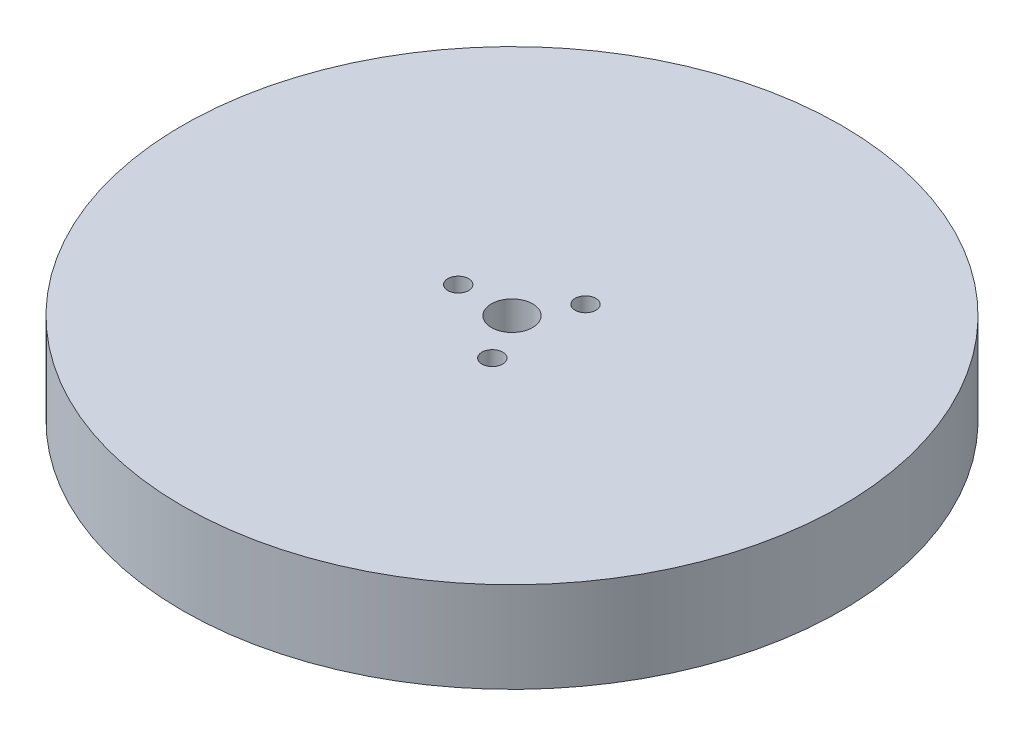
from build123d import *

# Parameters (mm, degrees)
SKETCH1_R           = 80
BOSS_EXTRUDE1_DEPTH = 22
SKETCH2_R           = 5
CUT_EXTRUDE1_DEPTH  = 116.256236274
SKETCH3_R           = 2.520042376
CUT_EXTRUDE2_DEPTH  = 17.07476964
CIRPATTERN1_COUNT   = 3


with BuildPart() as part:
    # Sketch1 → Boss-Extrude1 (new body)
    with BuildSketch(Plane(origin=(0, 0, 0), x_dir=(1, 0, 0), z_dir=(0, 1, 0))):
        Circle(SKETCH1_R)
    extrude(amount=BOSS_EXTRUDE1_DEPTH)

    # Sketch2 → Cut-Extrude1 (cut, through all)
    with BuildSketch(Plane(origin=(0, 0, 0), x_dir=(1, 0, 0), z_dir=(0, 1, 0))):
        Circle(SKETCH2_R)
    extrude(amount=CUT_EXTRUDE1_DEPTH, mode=Mode.SUBTRACT)

    # Sketch3 → Cut-Extrude2 (cut)
    with BuildSketch(Plane(origin=(0, 22, 0), x_dir=(1, 0, 0), z_dir=(0, 1, 0))):
        with Locations((-13.058893853, 0)):
            Circle(SKETCH3_R)
    cut_extrude2 = extrude(amount=-CUT_EXTRUDE2_DEPTH, mode=Mode.SUBTRACT)

    # CirPattern1: Cut-Extrude2 ×3 about axis
    cirpattern1_axis = Axis((0, 0, 0), (0, 1, 0))
    for i in range(1, CIRPATTERN1_COUNT):
        add(cut_extrude2.rotate(cirpattern1_axis, i * 360 / CIRPATTERN1_COUNT), mode=Mode.SUBTRACT)


solid = part.part
